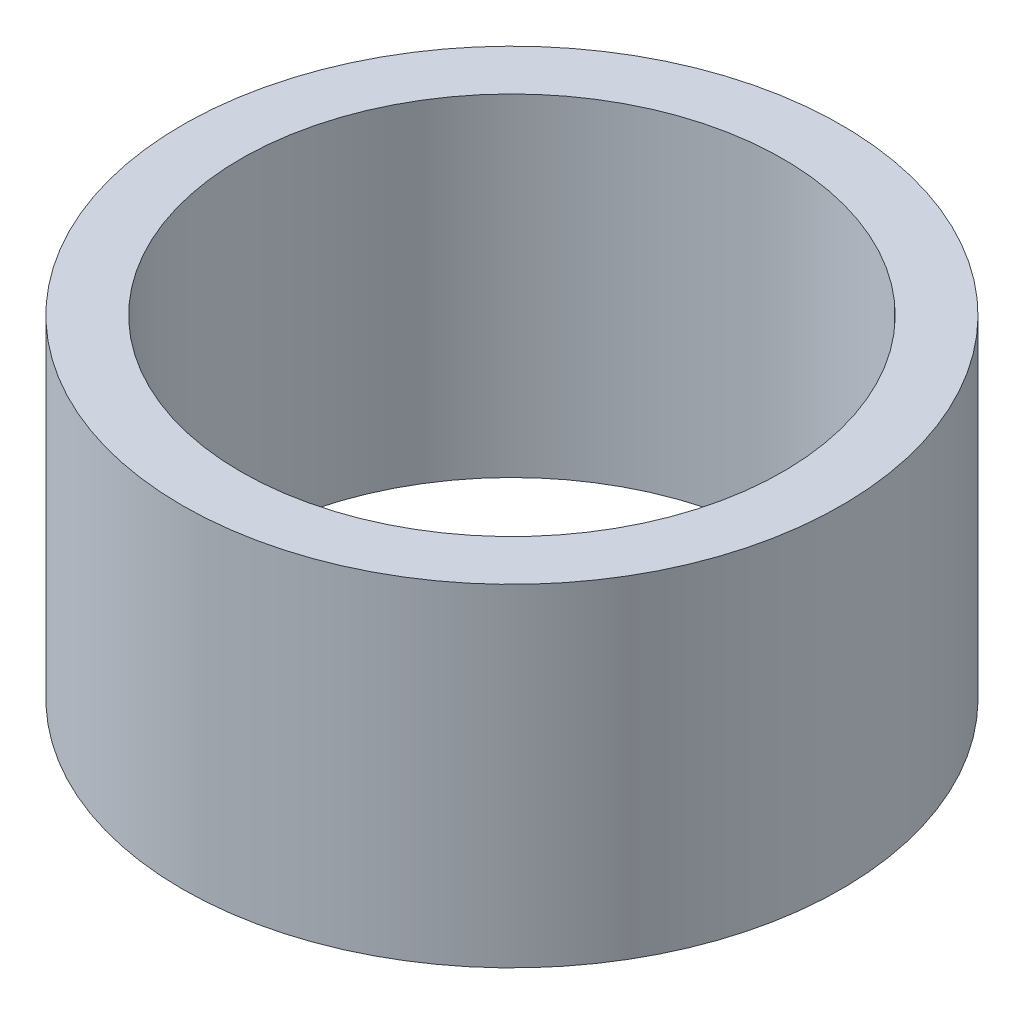
from build123d import *

# Parameters (mm, degrees)
SKETCH1_R           = 3.96875
SKETCH1_R_2         = 3.2639
BOSS_EXTRUDE1_DEPTH = 4


with BuildPart() as part:
    # Sketch1 → Boss-Extrude1 (new body)
    with BuildSketch(Plane(origin=(0, 0, 0), x_dir=(1, 0, 0), z_dir=(0, 1, 0))):
        Circle(SKETCH1_R)
        Circle(SKETCH1_R_2, mode=Mode.SUBTRACT)
    extrude(amount=BOSS_EXTRUDE1_DEPTH)


solid = part.part
